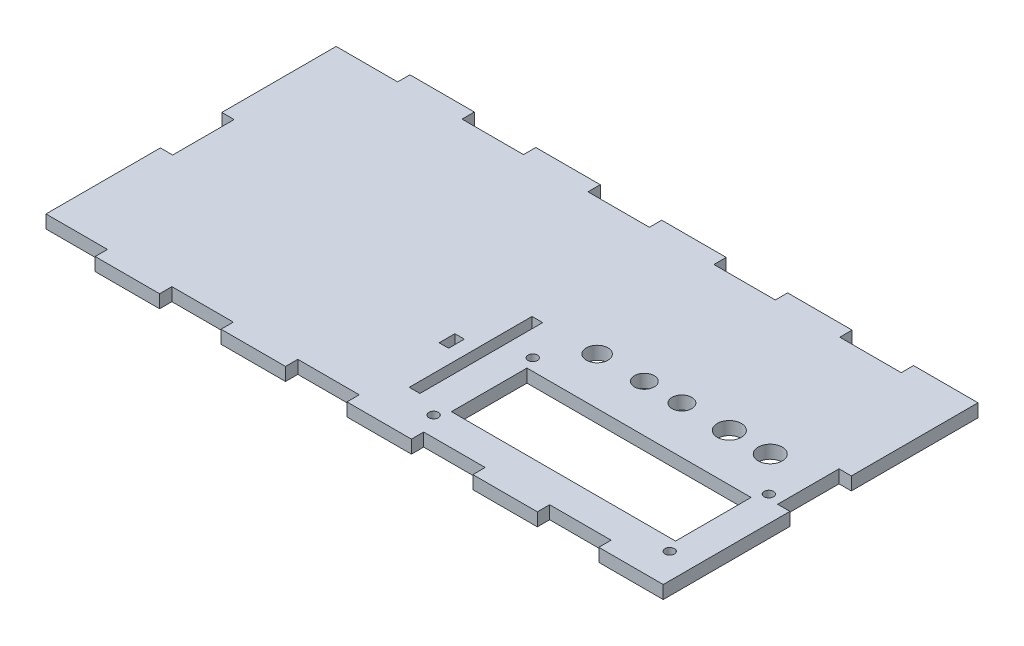
from build123d import *

# Parameters (mm, degrees)
SKETCH1_W           = 200
SKETCH1_H           = 100
BOSS_EXTRUDE1_DEPTH = 4.15
SKETCH3_W           = 19.52
SKETCH3_H           = 3.91
CUT_EXTRUDE2_DEPTH  = 10
SKETCH4_W           = 3.91
SKETCH4_H           = 19.52
CUT_EXTRUDE3_DEPTH  = 10
SKETCH7_W           = 71.2
SKETCH7_H           = 24
CUT_EXTRUDE6_DEPTH  = 10
SKETCH8_R           = 1.5
CUT_EXTRUDE7_DEPTH  = 10
SKETCH9_W           = 3.4
SKETCH9_H           = 39
CUT_EXTRUDE8_DEPTH  = 10
SKETCH10_R          = 3.425
CUT_EXTRUDE9_DEPTH  = 10
SKETCH11_R          = 3.125
CUT_EXTRUDE10_DEPTH = 10
SKETCH12_R          = 3.825
CUT_EXTRUDE11_DEPTH = 10
SKETCH19_W          = 3
SKETCH19_H          = 5
CUT_EXTRUDE19_DEPTH = 4.2


with BuildPart() as part:
    # Sketch1 → Boss-Extrude1 (new body)
    with BuildSketch(Plane(origin=(0, 0, 0), x_dir=(1, 0, 0), z_dir=(0, 1, 0))):
        Rectangle(SKETCH1_W, SKETCH1_H)
    extrude(amount=BOSS_EXTRUDE1_DEPTH)

    # Sketch3 → Cut-Extrude2 (cut)
    with BuildSketch(Plane(origin=(0, 4.15, 0), x_dir=(1, 0, 0), z_dir=(0, 1, 0))):
        with Locations((-90.24, 48.045)):
            Rectangle(SKETCH3_W, SKETCH3_H)
        with Locations((-90.24, -48.045)):
            Rectangle(SKETCH3_W, SKETCH3_H)
        with Locations((-50.24, 48.045)):
            Rectangle(SKETCH3_W, SKETCH3_H)
        with Locations((-10.24, 48.045)):
            Rectangle(SKETCH3_W, SKETCH3_H)
        with Locations((29.76, 48.045)):
            Rectangle(SKETCH3_W, SKETCH3_H)
        with Locations((69.76, 48.045)):
            Rectangle(SKETCH3_W, SKETCH3_H)
        with Locations((-50.24, -48.045)):
            Rectangle(SKETCH3_W, SKETCH3_H)
        with Locations((-10.24, -48.045)):
            Rectangle(SKETCH3_W, SKETCH3_H)
        with Locations((29.76, -48.045)):
            Rectangle(SKETCH3_W, SKETCH3_H)
        with Locations((69.76, -48.045)):
            Rectangle(SKETCH3_W, SKETCH3_H)
    extrude(amount=-CUT_EXTRUDE2_DEPTH, mode=Mode.SUBTRACT)

    # Sketch4 → Cut-Extrude3 (cut)
    with BuildSketch(Plane(origin=(0, 4.15, 0), x_dir=(1, 0, 0), z_dir=(0, 1, 0))):
        with Locations((-98.045, 0)):
            Rectangle(SKETCH4_W, SKETCH4_H)
        with Locations((98.045, 0)):
            Rectangle(SKETCH4_W, SKETCH4_H)
    extrude(amount=-CUT_EXTRUDE3_DEPTH, mode=Mode.SUBTRACT)

    # Sketch7 → Cut-Extrude6 (cut)
    with BuildSketch(Plane(origin=(0, 4.15, 0), x_dir=(1, 0, 0), z_dir=(0, 1, 0))):
        with Locations((54.4, -24.09)):
            Rectangle(SKETCH7_W, SKETCH7_H)
    extrude(amount=-CUT_EXTRUDE6_DEPTH, mode=Mode.SUBTRACT)

    # Sketch8 → Cut-Extrude7 (cut)
    with BuildSketch(Plane(origin=(0, 4.15, 0), x_dir=(1, 0, 0), z_dir=(0, 1, 0))):
        with Locations((16.9, -39.84)):
            Circle(SKETCH8_R)
        with Locations((16.9, -8.34)):
            Circle(SKETCH8_R)
        with Locations((91.9, -8.34)):
            Circle(SKETCH8_R)
        with Locations((91.9, -39.84)):
            Circle(SKETCH8_R)
    extrude(amount=-CUT_EXTRUDE7_DEPTH, mode=Mode.SUBTRACT)

    # Sketch9 → Cut-Extrude8 (cut)
    with BuildSketch(Plane(origin=(0, 4.15, 0), x_dir=(1, 0, 0), z_dir=(0, 1, 0))):
        with Locations((7.1, -16.59)):
            Rectangle(SKETCH9_W, SKETCH9_H)
    extrude(amount=-CUT_EXTRUDE8_DEPTH, mode=Mode.SUBTRACT)

    # Sketch10 → Cut-Extrude9 (cut)
    with BuildSketch(Plane(origin=(0, 4.15, 0), x_dir=(1, 0, 0), z_dir=(0, 1, 0))):
        with Locations((26.09, 2.91)):
            Circle(SKETCH10_R)
    extrude(amount=-CUT_EXTRUDE9_DEPTH, mode=Mode.SUBTRACT)

    # Sketch11 → Cut-Extrude10 (cut)
    with BuildSketch(Plane(origin=(0, 4.15, 0), x_dir=(1, 0, 0), z_dir=(0, 1, 0))):
        with Locations((41.09, 2.91)):
            Circle(SKETCH11_R)
        with Locations((53.030933996, 2.91)):
            Circle(SKETCH11_R)
    extrude(amount=-CUT_EXTRUDE10_DEPTH, mode=Mode.SUBTRACT)

    # Sketch12 → Cut-Extrude11 (cut)
    with BuildSketch(Plane(origin=(0, 4.15, 0), x_dir=(1, 0, 0), z_dir=(0, 1, 0))):
        with Locations((68.09, 2.91)):
            Circle(SKETCH12_R)
        with Locations((81.09, 2.91)):
            Circle(SKETCH12_R)
    extrude(amount=-CUT_EXTRUDE11_DEPTH, mode=Mode.SUBTRACT)

    # Sketch19 → Cut-Extrude19 (cut)
    with BuildSketch(Plane(origin=(0, 4.15, 0), x_dir=(1, 0, 0), z_dir=(0, 1, 0))):
        with Locations((-0.6, -16.59)):
            Rectangle(SKETCH19_W, SKETCH19_H)
    extrude(amount=-CUT_EXTRUDE19_DEPTH, mode=Mode.SUBTRACT)


solid = part.part
